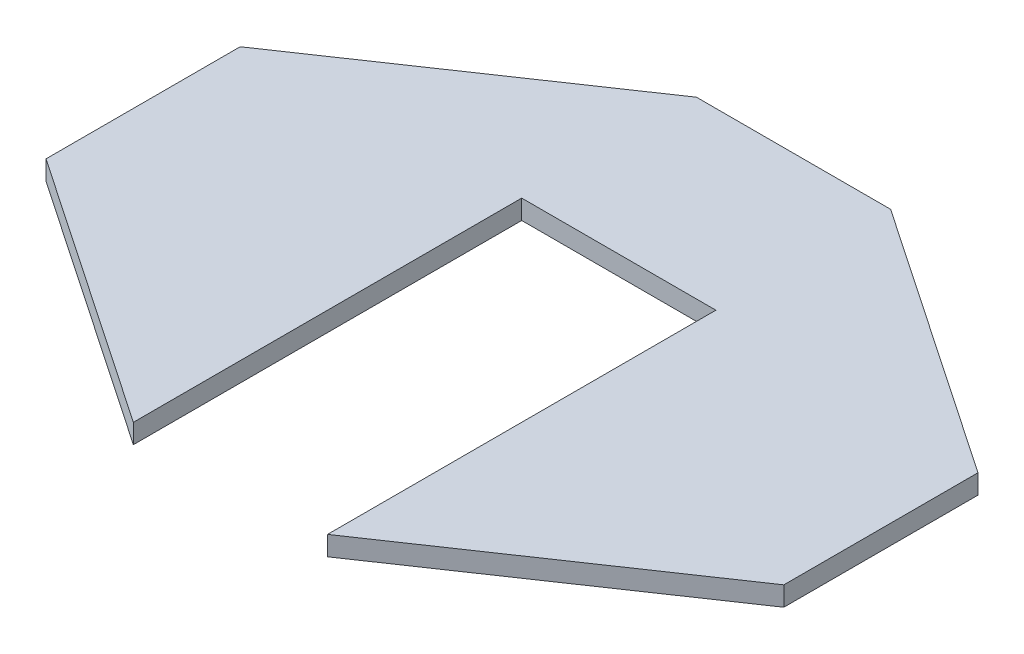
from build123d import *

# Parameters (mm, degrees)
BOSS_EXTRU_1_DEPTH      = 10
ESQUISSE3_W             = 100
ESQUISSE3_H             = 10
ENL_V_MAT_EXTRU_1_DEPTH = 200


with BuildPart() as part:
    # Esquisse1 → Boss.-Extru.1 (new body)
    with BuildSketch(Plane(origin=(0, 0, 0), x_dir=(1, 0, 0), z_dir=(0, 1, 0))):
        Polygon((-76.643189126, -51.401333399), (63.356810874, 43.598666601), (163.356810874, 43.598666601), (303.356810874, -51.401333399), (303.356810874, -151.401333399), (163.356810874, -246.401333399), (63.356810874, -246.401333399), (-76.643189126, -151.401333399), align=None)
    extrude(amount=BOSS_EXTRU_1_DEPTH)

    # Esquisse3 → Enlèv. mat.-Extru.1 (cut)
    with BuildSketch(Plane.XY.offset(246.401333399)):
        with Locations((113.356810874, 5)):
            Rectangle(ESQUISSE3_W, ESQUISSE3_H)
    extrude(amount=-ENL_V_MAT_EXTRU_1_DEPTH, mode=Mode.SUBTRACT)


solid = part.part
